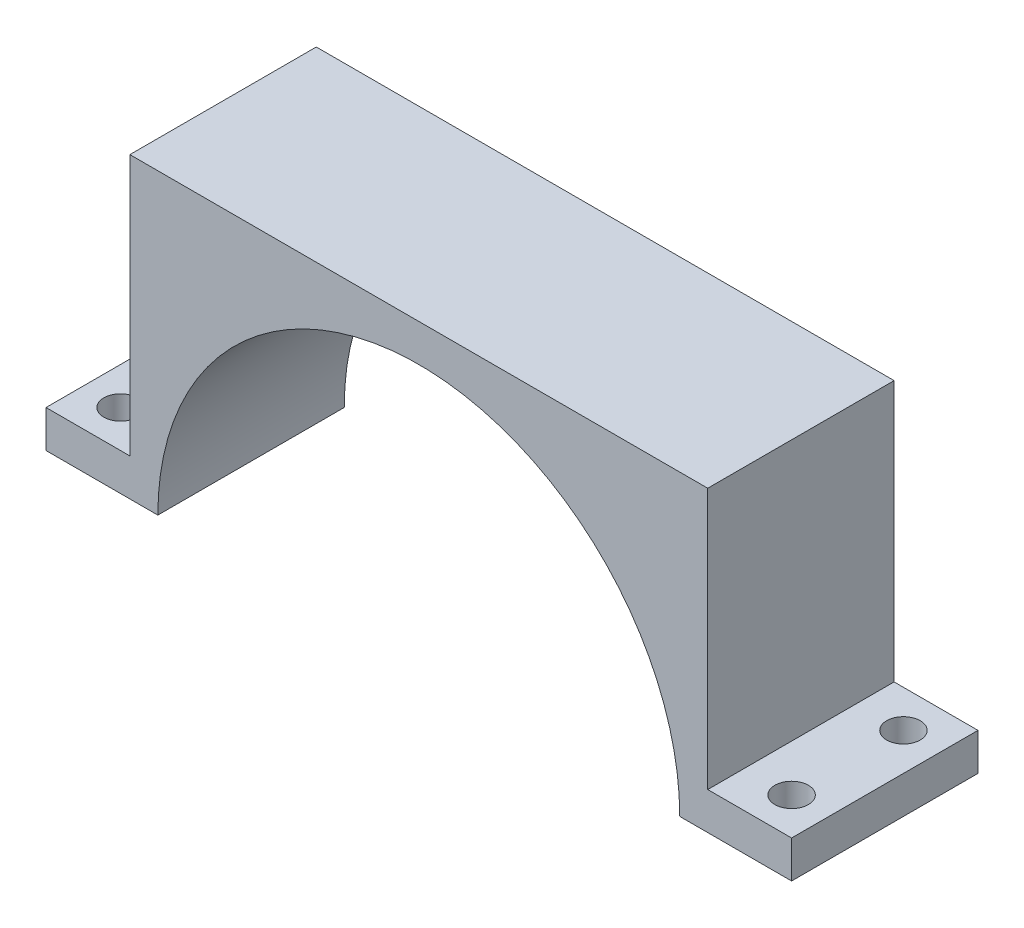
from build123d import *

# Parameters (mm, degrees)
DODANIE_WYCI_GNI_CIE1_DEPTH = 50
SZKIC2_R                    = 4.5
WYTNIJ_WYCI_GNI_CIE1_DEPTH  = 50


with BuildPart() as part:
    # Szkic1 → Dodanie-wyciągnięcie1 (new body)
    with BuildSketch(Plane.XY):
        with BuildLine():
            Line((70, 0), (100, 0))
            Line((100, 0), (100, 10))
            Line((100, 10), (77.5, 10))
            Line((77.5, 10), (77.5, 80))
            Line((77.5, 80), (-77.5, 80))
            Line((-77.5, 80), (-77.5, 10))
            Line((-77.5, 10), (-100, 10))
            Line((-100, 10), (-100, 0))
            Line((-100, 0), (-70, 0))
            ThreePointArc((-70, 0), (0, 70), (70, 0))
        make_face()
    extrude(amount=DODANIE_WYCI_GNI_CIE1_DEPTH)

    # Szkic2 → Wytnij-wyciągnięcie1 (cut)
    with BuildSketch(Plane(origin=(0, 10, 0), x_dir=(1, 0, 0), z_dir=(0, 1, 0))):
        with Locations((-90, -10)):
            Circle(SZKIC2_R)
        with Locations((-90, -40)):
            Circle(SZKIC2_R)
    wytnij_wyci_gni_cie1 = extrude(amount=-WYTNIJ_WYCI_GNI_CIE1_DEPTH, mode=Mode.SUBTRACT)

    # Lustro1: Wytnij-wyciągnięcie1 across plane
    add(wytnij_wyci_gni_cie1.mirror(Plane(origin=(0, 0, 0), x_dir=(0, 0, 1), z_dir=(1, 0, 0))), mode=Mode.SUBTRACT)


solid = part.part
